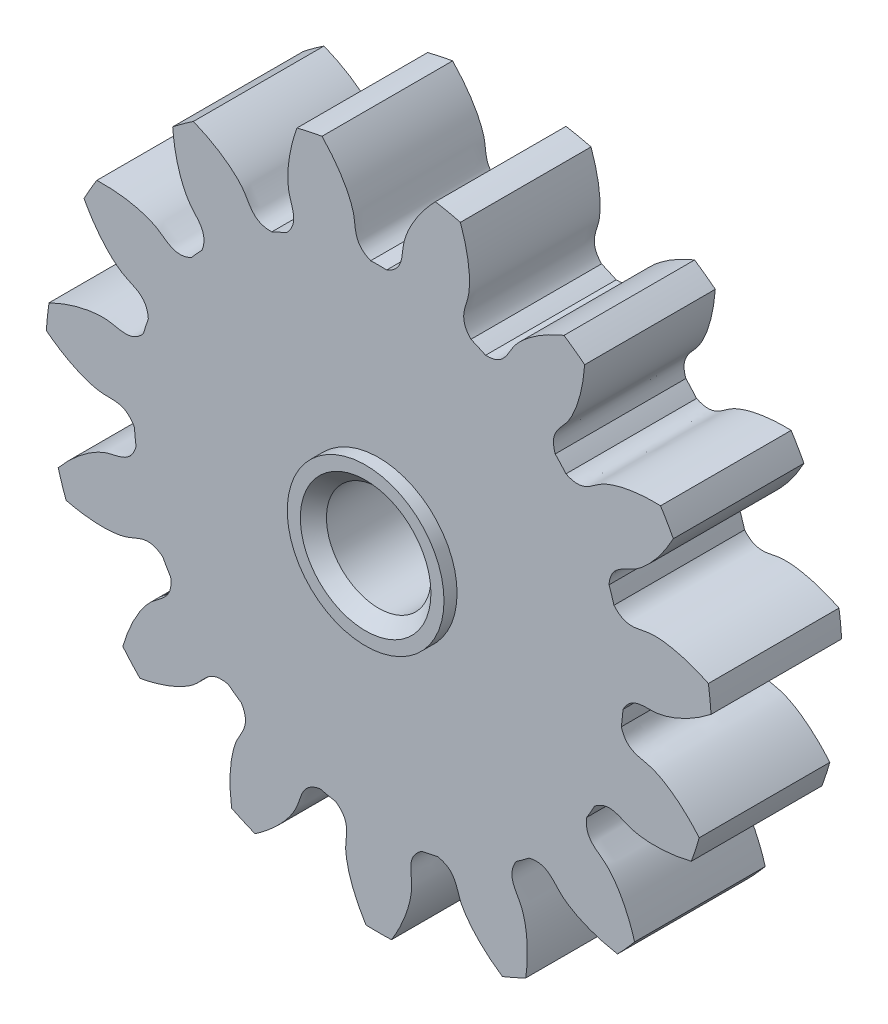
from build123d import *

# Parameters (mm, degrees)
SKETCH_1_R               = 12.75
EXTRUDE_1_DEPTH          = 5
CUT_EXTRUDE_1_DEPTH      = 19.711627401
PATTERN_CIRCULAR_1_COUNT = 15
SKETCH_4_R               = 2
CUT_EXTRUDE_2_DEPTH      = 19.69255157
EXTRUDE_START            = 0.5
SKETCH_5_R               = 3
SKETCH_5_R_2             = 2
EXTRUDE_2_DEPTH          = 0.5
CHAMFER_1_SIZE           = 0.5


with BuildPart() as part:
    # 草图1 → 凸台-拉伸1 (new body)
    with BuildSketch(Plane.XY):
        Circle(SKETCH_1_R)
    extrude(amount=EXTRUDE_1_DEPTH)

    # 草图2 → 切除-拉伸1 (cut, through all)
    with BuildSketch(Plane.XY):
        with BuildLine():
            ThreePointArc((0.306427562, 9.369990776), (0, 9.375), (-0.306427562, 9.369990776))
            add(Edge.make_bspline(
                [(-0.306427562, 9.369990776), (-0.985819588, 9.651615343), (-0.858169701, 10.179494134), (-0.97689073, 10.662755648), (-0.986149768, 10.697487444), (-0.997273271, 10.736090735), (-1.010415356, 10.778503957), (-1.025733602, 10.824659963), (-1.043382046, 10.874487146), (-1.063513204, 10.92790915), (-1.086277288, 10.984845026), (-1.111822276, 11.04520926), (-1.140293737, 11.10891184), (-1.171834724, 11.175858315), (-1.206585651, 11.245949863), (-1.244684177, 11.319083356), (-1.286265091, 11.395151435), (-1.331460195, 11.474042582), (-1.380398197, 11.555641197), (-1.433204596, 11.639827679), (-1.490001574, 11.726478508), (-1.550907895, 11.81546633), (-1.616038794, 11.906660045), (-1.685505881, 11.999924899), (-1.759417036, 12.095122575), (-1.837876316, 12.192111292), (-1.920983857, 12.290745898), (-2.008835785, 12.390877976), (-2.101524119, 12.492355945), (-2.199136692, 12.595025163), (-2.301757059, 12.698728038), (-2.409464417, 12.803304135), (-2.522333527, 12.90859029), (-2.640434633, 13.014420721), (-2.763833392, 13.120627146), (-2.8925908, 13.227038901), (-3.026763122, 13.333483058), (-3.166401833, 13.439784546), (-3.311553545, 13.545766275), (-3.462259959, 13.651249263), (-3.618557797, 13.756052756), (-3.78047876, 13.859994363), (-3.948049464, 13.962890179), (-4.121291414, 14.06455492), (-4.300220913, 14.164802055), (-4.548878493, 14.297653055), (-4.74022787, 14.392550949), (-4.870257583, 14.45389231)],
                knots=[0, 0, 0, 0, 0.202473101, 0.206978902, 0.212085478, 0.217792827, 0.224100949, 0.231009845, 0.238519514, 0.246629958, 0.255341174, 0.264653164, 0.274565928, 0.285079465, 0.296193776, 0.307908861, 0.320224719, 0.33314135, 0.346658755, 0.360776934, 0.375495886, 0.390815612, 0.406736111, 0.423257384, 0.440379431, 0.458102251, 0.476425844, 0.495350211, 0.514875352, 0.535001266, 0.555727954, 0.577055415, 0.59898365, 0.621512658, 0.64464244, 0.668372996, 0.692704325, 0.717636428, 0.743169304, 0.769302954, 0.796037377, 0.823372574, 0.851308544, 0.879845288, 0.908982806, 0.938721097, 1, 1, 1, 1], degree=3))
            ThreePointArc((-4.870257583, 14.45389231), (0, 15.252357583), (4.870257583, 14.45389231))
            add(Edge.make_bspline(
                [(0.306427562, 9.369990776), (0.985819588, 9.651615343), (0.858169701, 10.179494134), (0.97689073, 10.662755648), (0.986149768, 10.697487444), (0.997273271, 10.736090735), (1.010415356, 10.778503957), (1.025733602, 10.824659963), (1.043382046, 10.874487146), (1.063513204, 10.92790915), (1.086277288, 10.984845026), (1.111822276, 11.04520926), (1.140293737, 11.10891184), (1.171834724, 11.175858315), (1.206585651, 11.245949863), (1.244684177, 11.319083356), (1.286265091, 11.395151435), (1.331460195, 11.474042582), (1.380398197, 11.555641197), (1.433204596, 11.639827679), (1.490001574, 11.726478508), (1.550907895, 11.81546633), (1.616038794, 11.906660045), (1.685505881, 11.999924899), (1.759417036, 12.095122575), (1.837876316, 12.192111292), (1.920983857, 12.290745898), (2.008835785, 12.390877976), (2.101524119, 12.492355945), (2.199136692, 12.595025163), (2.301757059, 12.698728038), (2.409464417, 12.803304135), (2.522333527, 12.90859029), (2.640434633, 13.014420721), (2.763833392, 13.120627146), (2.8925908, 13.227038901), (3.026763122, 13.333483058), (3.166401833, 13.439784546), (3.311553545, 13.545766275), (3.462259959, 13.651249263), (3.618557797, 13.756052756), (3.78047876, 13.859994363), (3.948049464, 13.962890179), (4.121291414, 14.06455492), (4.300220913, 14.164802055), (4.548878493, 14.297653055), (4.74022787, 14.392550949), (4.870257583, 14.45389231)],
                knots=[0, 0, 0, 0, 0.202473101, 0.206978902, 0.212085478, 0.217792827, 0.224100949, 0.231009845, 0.238519514, 0.246629958, 0.255341174, 0.264653164, 0.274565928, 0.285079465, 0.296193776, 0.307908861, 0.320224719, 0.33314135, 0.346658755, 0.360776934, 0.375495886, 0.390815612, 0.406736111, 0.423257384, 0.440379431, 0.458102251, 0.476425844, 0.495350211, 0.514875352, 0.535001266, 0.555727954, 0.577055415, 0.59898365, 0.621512658, 0.64464244, 0.668372996, 0.692704325, 0.717636428, 0.743169304, 0.769302954, 0.796037377, 0.823372574, 0.851308544, 0.879845288, 0.908982806, 0.938721097, 1, 1, 1, 1], degree=3))
        make_face()
    cut_extrude_1 = extrude(amount=CUT_EXTRUDE_1_DEPTH, mode=Mode.SUBTRACT)

    # 阵列(圆周)1: 切除-拉伸1 ×15 about axis
    pattern_circular_1_axis = Axis((0, 0, -0.25), (0, 0, 1))
    for i in range(1, PATTERN_CIRCULAR_1_COUNT):
        add(cut_extrude_1.rotate(pattern_circular_1_axis, i * 360 / PATTERN_CIRCULAR_1_COUNT), mode=Mode.SUBTRACT)

    # 草图4 → 切除-拉伸2 (cut, through all)
    with BuildSketch(Plane.XY.offset(5)):
        Circle(SKETCH_4_R)
    extrude(amount=-CUT_EXTRUDE_2_DEPTH, mode=Mode.SUBTRACT)

    # 草图5 → 凸台-拉伸2 (add)
    with BuildSketch(Plane.XY.offset(5).offset(EXTRUDE_START)):
        Circle(SKETCH_5_R)
        Circle(SKETCH_5_R_2, mode=Mode.SUBTRACT)
    extrude(amount=-EXTRUDE_2_DEPTH)

    # 倒角1
    chamfer_1_edges = [part.edges().sort_by_distance(p)[0] for p in [
        (-2, 0, 0),
        (-2, 0, 5.5),
    ]]
    chamfer(chamfer_1_edges, length=CHAMFER_1_SIZE)


solid = part.part
